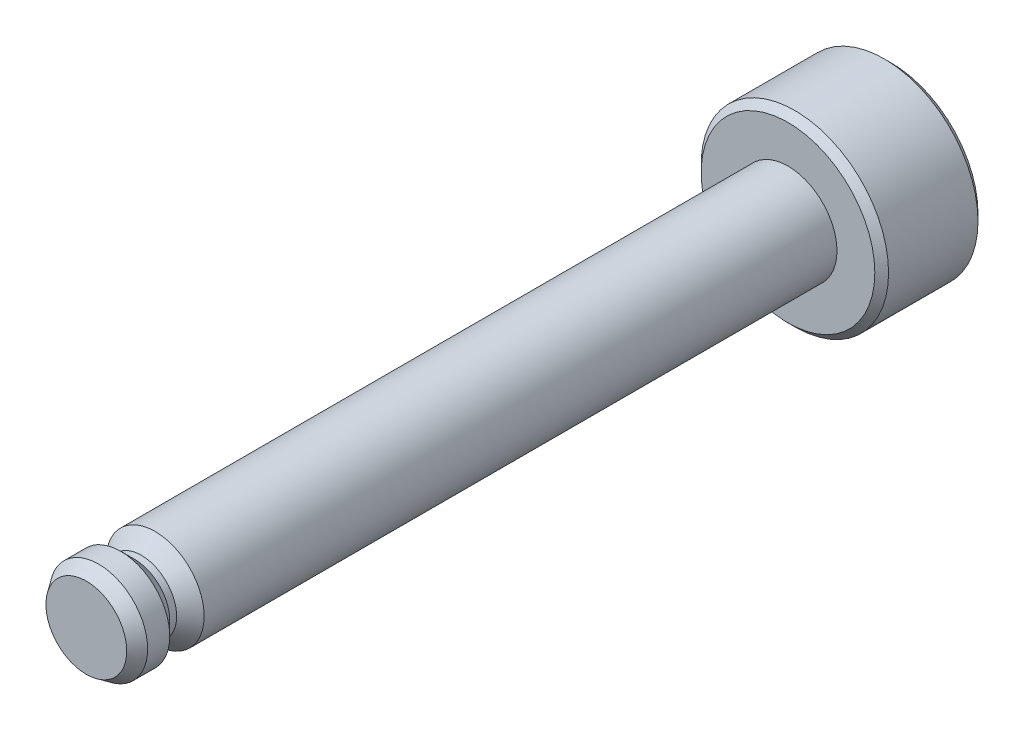
from build123d import *

# Parameters (mm, degrees)
SKETCH2_R      = 1.425
SHAFT_DEPTH    = 20.4
SKETCH5_R      = 2.725
HEAD_DEPTH     = 3
CHAMFER1_SIZE  = 0.25
CHAMFER1_SIZE2 = 0.357037002
DEBURS_SIZE    = 0.2


with BuildPart() as part:
    # Sketch2 → Shaft (new body)
    with BuildSketch(Plane.XY):
        Circle(SKETCH2_R)
    extrude(amount=SHAFT_DEPTH)

    # Sketch5 → Head (add)
    with BuildSketch(Plane.XY):
        Circle(SKETCH5_R)
    extrude(amount=-HEAD_DEPTH)

    # Sketch4 → e-Clip Notch Short (revolve, cut)
    with BuildSketch(Plane(origin=(0, 0, 0), x_dir=(0, 0, -1), z_dir=(1, 0, 0))):
        Polygon((-19.4, 1.425), (-18.4, 1.425), (-18.8, 1.025), (-19, 1.025), align=None)
    revolve(axis=Axis((0, 0, 0), (0, 0, 1)), mode=Mode.SUBTRACT)

    # Chamfer1
    chamfer1_edges = [part.edges().sort_by_distance(p)[0] for p in [
        (-1.425, 0, 20.4),
    ]]
    chamfer1_side = [part.faces().sort_by_distance(p)[0] for p in [
        (0, 0, 20.4),
    ]]
    chamfer(chamfer1_edges, length=CHAMFER1_SIZE, length2=CHAMFER1_SIZE2, reference=chamfer1_side[0])

    # Deburs
    deburs_edges = [part.edges().sort_by_distance(p)[0] for p in [
        (-2.725, 0, 0),
        (-2.725, 0, -3),
    ]]
    chamfer(deburs_edges, length=DEBURS_SIZE)


solid = part.part
